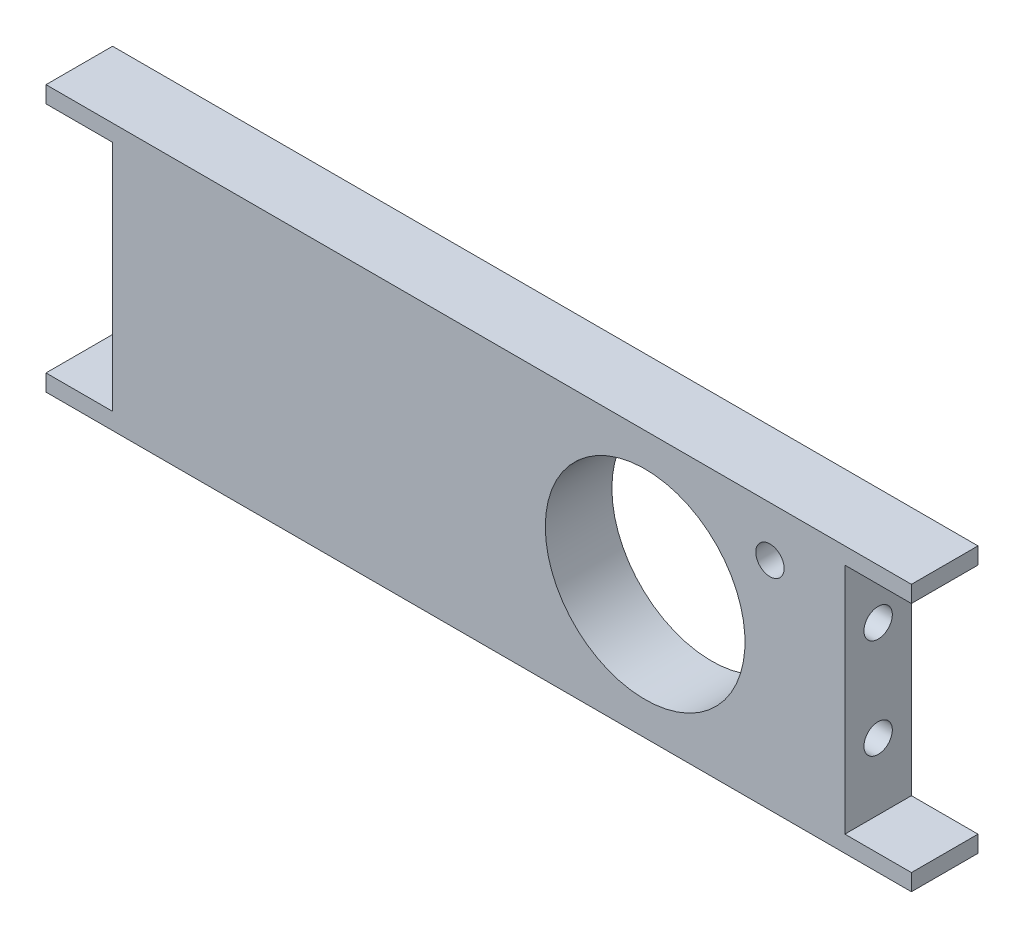
from build123d import *

# Parameters (mm, degrees)
BOSS_EXTRUDE1_DEPTH                = 6.35
TAP_DRILL_FOR_6_32_TAP1_AT_2_COUNT = 2
TAP_DRILL_FOR_6_32_TAP1_AT_2_PITCH = 9.525
SKETCH5_R                          = 9.525
CUT_EXTRUDE1_DEPTH                 = 44.649033494
TAP_DRILL_FOR_6_32_TAP2_D          = 2.7051


with BuildPart() as part:
    # Sketch1 → Boss-Extrude1 (new body)
    with BuildSketch(Plane.XY):
        Polygon((-41.275, -12.7), (41.275, -12.7), (41.275, -11.1125), (34.925, -11.1125), (34.925, 11.1125), (41.275, 11.1125), (41.275, 12.7), (-41.275, 12.7), (-41.275, 11.1125), (-34.925, 11.1125), (-34.925, -11.1125), (-41.275, -11.1125), align=None)
    extrude(amount=BOSS_EXTRUDE1_DEPTH)

    # Sketch4 → Tap Drill for #6-32 Tap1 (revolve, cut)
    with BuildSketch(Plane(origin=(34.925, 4.7625, 3.175), x_dir=(0, 0, -1), z_dir=(0, 1, 0))):
        Polygon((0, 0), (0, 7.16269403), (1.35255, 6.35), (1.35255, 0), align=None)
    tap_drill_for_6_32_tap1 = revolve(axis=Axis((41.275, 4.7625, 3.175), (-1, 0, 0)), mode=Mode.SUBTRACT)

    # Tap Drill for #6-32 Tap1 at 2: Tap Drill for #6-32 Tap1 ×2
    with Locations(*[(0, -i * TAP_DRILL_FOR_6_32_TAP1_AT_2_PITCH, 0) for i in range(1, TAP_DRILL_FOR_6_32_TAP1_AT_2_COUNT)]):
        add(tap_drill_for_6_32_tap1, mode=Mode.SUBTRACT)

    # Mirror1: Tap Drill for #6-32 Tap1 across plane
    add(tap_drill_for_6_32_tap1.mirror(Plane.ZY), mode=Mode.SUBTRACT)

    # Mirror1 copy 1 sketch → Mirror1 copy 1 (revolve, cut)
    with BuildSketch(Plane(origin=(-34.925, -4.7625, 3.175), x_dir=(0, 0, -1), z_dir=(0, 1, 0))):
        Polygon((0, 0), (0, -7.16269403), (1.35255, -6.35), (1.35255, 0), align=None)
    revolve(axis=Axis((-41.275, -4.7625, 3.175), (-1, 0, 0)), mode=Mode.SUBTRACT)

    # Sketch5 → Cut-Extrude1 (cut, through all)
    with BuildSketch(Plane(origin=(0, 0, 0), x_dir=(-1, 0, 0), z_dir=(0, 0, -1))):
        with Locations((-15.875, 0)):
            Circle(SKETCH5_R)
    extrude(amount=-CUT_EXTRUDE1_DEPTH, mode=Mode.SUBTRACT)

    # Tap Drill for #6-32 Tap2 (through all)
    with Locations(Plane(origin=(0, 0, 0), x_dir=(-1, 0, 0), z_dir=(0, 0, -1))):
        with Locations((-27.78125, 7.9375)):
            Hole(TAP_DRILL_FOR_6_32_TAP2_D / 2)


solid = part.part
